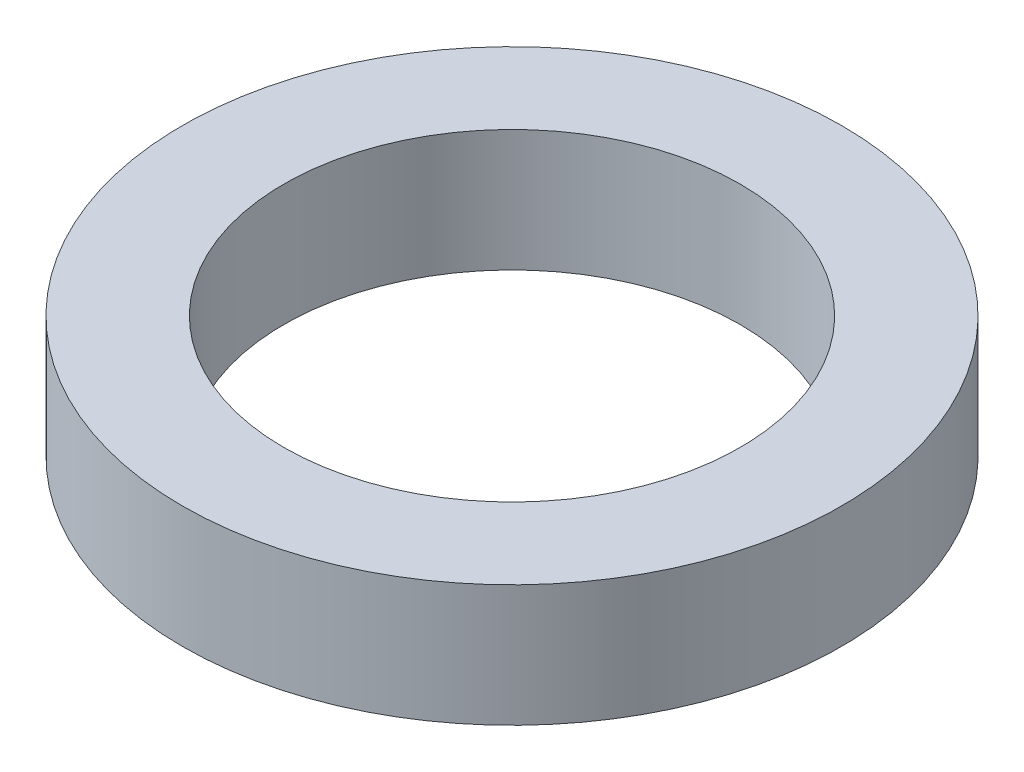
from build123d import *

# Parameters (mm, degrees)
SKETCH1_R           = 32.5
BOSS_EXTRUDE1_DEPTH = 12
SKETCH2_R           = 22.5
CUT_EXTRUDE1_DEPTH  = 48.502631506


with BuildPart() as part:
    # Sketch1 → Boss-Extrude1 (new body)
    with BuildSketch(Plane(origin=(0, 0, 0), x_dir=(1, 0, 0), z_dir=(0, 1, 0))):
        Circle(SKETCH1_R)
    extrude(amount=BOSS_EXTRUDE1_DEPTH)

    # Sketch2 → Cut-Extrude1 (cut, through all)
    with BuildSketch(Plane(origin=(0, 0, 0), x_dir=(1, 0, 0), z_dir=(0, 1, 0))):
        Circle(SKETCH2_R)
    extrude(amount=CUT_EXTRUDE1_DEPTH, mode=Mode.SUBTRACT)


solid = part.part
